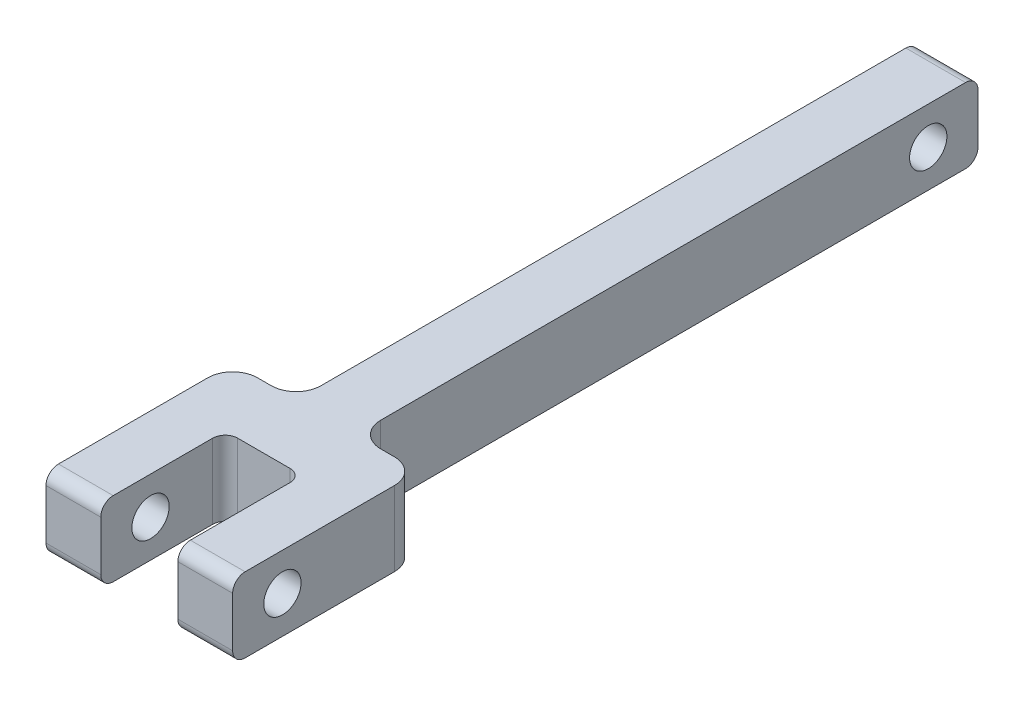
from build123d import *
from build123d.topology import SkipClean

# Parameters (mm, degrees)
SALIENTE_EXTRUIR1_DEPTH    = 2.4
CORTAR_EXTRUIR1_DEPTH      = 33.726289127
CORTAR_EXTRUIR1_DEPTH_BACK = 33.726289127
CROQUIS2_R                 = 1.5
CROQUIS3_R                 = 1.5
SALIENTE_EXTRUIR2_DEPTH    = 7.5
CORTAR_EXTRUIR2_DEPTH      = 3.1
REDONDEO1_R                = 2
REDONDEO2_R                = 1


with BuildPart() as part:
    # Croquis1 → Saliente-Extruir1 (new, symmetric)
    with BuildSketch(Plane(origin=(0, 0, 0), x_dir=(0, 0, -1), z_dir=(1, 0, 0))):
        with BuildLine():
            Line((-31.5, 3), (31.5, 3))
            ThreePointArc((31.5, 3), (32.207106781, 2.707106781), (32.5, 2))
            Line((32.5, 2), (32.5, -2))
            ThreePointArc((32.5, -2), (32.207106781, -2.707106781), (31.5, -3))
            Line((31.5, -3), (-31.5, -3))
            ThreePointArc((-31.5, -3), (-32.207106781, -2.707106781), (-32.5, -2))
            Line((-32.5, -2), (-32.5, 2))
            ThreePointArc((-32.5, 2), (-32.207106781, 2.707106781), (-31.5, 3))
        make_face()
    extrude(amount=SALIENTE_EXTRUIR1_DEPTH, both=True)

    # Croquis2 → Cortar-Extruir1 (cut, two sides: drawn at the far end of the back side and taken through both)
    with BuildSketch(Plane(origin=(0, 0, 0), x_dir=(0, 0, -1), z_dir=(1, 0, 0)).offset(-CORTAR_EXTRUIR1_DEPTH_BACK)):
        with Locations((-28.5, 0)):
            Circle(CROQUIS2_R)
        with Locations((28.5, 0)):
            Circle(CROQUIS2_R)
    extrude(amount=CORTAR_EXTRUIR1_DEPTH + CORTAR_EXTRUIR1_DEPTH_BACK, mode=Mode.SUBTRACT)

    # Croquis3 → Saliente-Extruir2 (add, symmetric)
    with SkipClean():  # the faces are left unmerged after this step: merging them gives an invalid solid
        with BuildSketch(Plane(origin=(0, 0, 0), x_dir=(0, 0, -1), z_dir=(1, 0, 0))):
            with BuildLine():
                Line((-32.5, 2), (-32.5, -2))
                ThreePointArc((-32.5, -2), (-32.207106781, -2.707106781), (-31.5, -3))
                Line((-31.5, -3), (-17.5, -3))
                Line((-17.5, -3), (-17.5, 3))
                Line((-17.5, 3), (-31.5, 3))
                ThreePointArc((-31.5, 3), (-32.207106781, 2.707106781), (-32.5, 2))
            make_face()
            with Locations((-28.5, 0)):
                Circle(CROQUIS3_R, mode=Mode.SUBTRACT)
        extrude(amount=SALIENTE_EXTRUIR2_DEPTH, both=True)
    add(part.part.scale(1), mode=Mode.REPLACE)  # the faces are merged on a copy

    # Croquis4 → Cortar-Extruir2 (cut, symmetric)
    with BuildSketch(Plane(origin=(0, 0, 0), x_dir=(0, 0, -1), z_dir=(1, 0, 0))):
        with BuildLine():
            Line((-31.5, 3), (-22.5, 3))
            Line((-22.5, 3), (-22.5, -3))
            Line((-22.5, -3), (-31.5, -3))
            ThreePointArc((-31.5, -3), (-32.207106781, -2.707106781), (-32.5, -2))
            Line((-32.5, -2), (-32.5, 2))
            ThreePointArc((-32.5, 2), (-32.207106781, 2.707106781), (-31.5, 3))
        make_face()
    extrude(amount=CORTAR_EXTRUIR2_DEPTH, both=True, mode=Mode.SUBTRACT)

    # Redondeo1
    redondeo1_edges = [part.edges().sort_by_distance(p)[0] for p in [
        (2.4, 0, 17.5),
        (-2.4, 0, 17.5),
        (7.5, 0, 17.5),
        (-7.5, 0, 17.5),
    ]]
    fillet(redondeo1_edges, radius=REDONDEO1_R)

    # Redondeo2
    redondeo2_edges = [part.edges().sort_by_distance(p)[0] for p in [
        (3.1, 0, 22.5),
        (-3.1, 0, 22.5),
    ]]
    fillet(redondeo2_edges, radius=REDONDEO2_R)


solid = part.part
